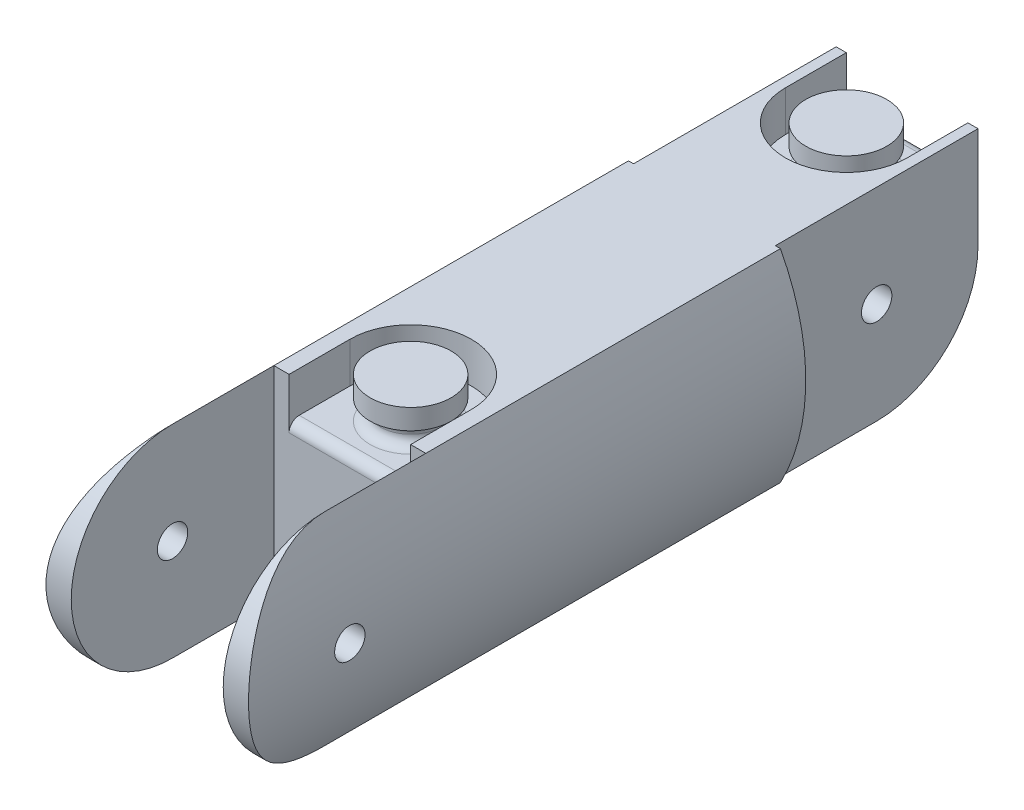
from build123d import *

# Parameters (mm, degrees)
SALIENTE_EXTRUIR2_DEPTH    = 55
CROQUIS4_R                 = 1.5
CORTAR_EXTRUIR1_DEPTH      = 50
SALIENTE_EXTRUIR3_DEPTH    = 20
CROQUIS8_R                 = 1.5
CORTAR_EXTRUIR4_DEPTH      = 14
REDONDEO1_R                = 10
CROQUIS6_W                 = 15
CROQUIS6_H                 = 20
CORTAR_EXTRUIR2_DEPTH      = 20
CORTAR_EXTRUIR3_DEPTH      = 57.789083458
CORTAR_EXTRUIR3_DEPTH_BACK = 57.789083458
CROQUIS7_R                 = 1.5
CUT_EXTRUDE1_DEPTH         = 4
SKETCH2_R                  = 3
BOSS_EXTRUDE1_DEPTH        = 2
SKETCH3_R                  = 4
BOSS_EXTRUDE2_DEPTH        = 2
FILLET1_R                  = 1
FILLET2_R                  = 1
FILLET3_R                  = 1


with BuildPart() as part:
    # Croquis2 → Saliente-Extruir2 (new body)
    with BuildSketch(Plane.XY):
        with BuildLine():
            Line((-7.5, -10), (7.5, -10))
            ThreePointArc((7.5, -10), (10, 0), (7.5, 10))
            Line((7.5, 10), (-7.5, 10))
            ThreePointArc((-7.5, 10), (-10, 0), (-7.5, -10))
        make_face()
    extrude(amount=SALIENTE_EXTRUIR2_DEPTH)

    # Croquis4 → Cortar-Extruir1 (cut)
    with BuildSketch(Plane(origin=(0, 0, 0), x_dir=(-1, 0, 0), z_dir=(0, 0, -1))):
        with Locations((0, -7)):
            Circle(CROQUIS4_R)
    extrude(amount=-CORTAR_EXTRUIR1_DEPTH, mode=Mode.SUBTRACT)

    # Croquis3 → Saliente-Extruir3 (add)
    with BuildSketch(Plane(origin=(0, 0, 0), x_dir=(-1, 0, 0), z_dir=(0, 0, -1))):
        Polygon((7, 10), (7, -10), (3, -10), (3, -3), (-3, -3), (-3, -10), (-7, -10), (-7, 10), align=None)
    extrude(amount=SALIENTE_EXTRUIR3_DEPTH)

    # Croquis8 → Cortar-Extruir4 (cut)
    with BuildSketch(Plane.ZY.offset(7)):
        with Locations((-10, 0)):
            Circle(CROQUIS8_R)
    extrude(amount=-CORTAR_EXTRUIR4_DEPTH, mode=Mode.SUBTRACT)

    # Redondeo1
    redondeo1_edges = [part.edges().sort_by_distance(p)[0] for p in [
        (5, -10, -20),
    ]]
    fillet(redondeo1_edges, radius=REDONDEO1_R)

    # Croquis6 → Cortar-Extruir2 (cut)
    with BuildSketch(Plane.XY.offset(55)):
        Rectangle(CROQUIS6_W, CROQUIS6_H)
    extrude(amount=-CORTAR_EXTRUIR2_DEPTH, mode=Mode.SUBTRACT)

    # Croquis7 → Cortar-Extruir3 (cut, two sides: drawn at the far end of the back side and taken through both)
    with BuildSketch(Plane(origin=(0, 0, 0), x_dir=(0, 0, -1), z_dir=(1, 0, 0)).offset(-CORTAR_EXTRUIR3_DEPTH_BACK)):
        with Locations((-45, 0)):
            Circle(CROQUIS7_R)
        with BuildLine():
            Line((-45, -10), (-60, -10))
            Line((-60, -10), (-60, 10))
            Line((-60, 10), (-45, 10))
            ThreePointArc((-45, 10), (-55, 0), (-45, -10))
        make_face()
    extrude(amount=CORTAR_EXTRUIR3_DEPTH + CORTAR_EXTRUIR3_DEPTH_BACK, mode=Mode.SUBTRACT)

    # Sketch1 → Cut-Extrude1 (cut)
    with BuildSketch(Plane(origin=(0, 10, 0), x_dir=(1, 0, 0), z_dir=(0, 1, 0))):
        with BuildLine():
            Line((-6, 14), (-6, 20))
            Line((-6, 20), (6, 20))
            Line((6, 20), (6, 14))
            ThreePointArc((6, 14), (0, 8), (-6, 14))
        make_face()
        with BuildLine():
            Line((-6, -29), (-6, -35))
            Line((-6, -35), (6, -35))
            Line((6, -35), (6, -29))
            ThreePointArc((6, -29), (0, -23), (-6, -29))
        make_face()
    extrude(amount=-CUT_EXTRUDE1_DEPTH, mode=Mode.SUBTRACT)

    # Sketch2 → Boss-Extrude1 (add)
    with BuildSketch(Plane(origin=(0, 6, 0), x_dir=(1, 0, 0), z_dir=(0, 1, 0))):
        with Locations(Location((0, -29, 0), (0, 0, 270))):
            Circle(SKETCH2_R)
        with Locations(Location((0, 14, 0), (0, 0, 270))):
            Circle(SKETCH2_R)
    extrude(amount=BOSS_EXTRUDE1_DEPTH)

    # Sketch3 → Boss-Extrude2 (add)
    with BuildSketch(Plane(origin=(0, 8, 0), x_dir=(1, 0, 0), z_dir=(0, 1, 0))):
        with Locations(Location((0, 14, 0), (0, 0, 270))):
            Circle(SKETCH3_R)
        with Locations(Location((0, -29, 0), (0, 0, 270))):
            Circle(SKETCH3_R)
    extrude(amount=BOSS_EXTRUDE2_DEPTH)

    # Fillet1
    fillet1_edges = [part.edges().sort_by_distance(p)[0] for p in [
        (0, 6, 26),
        (0, 8, 26),
        (0, 6, -17),
        (0, 8, -17),
    ]]
    fillet(fillet1_edges, radius=FILLET1_R - 0.0001)  # a hair under: the kernel refuses the full size

    # Fillet2
    fillet2_edges = [part.edges().sort_by_distance(p)[0] for p in [
        (0, 6, -20),
        (0, 6, 35),
    ]]
    fillet(fillet2_edges, radius=FILLET2_R)

    # Fillet3
    fillet3_edges = [part.edges().sort_by_distance(p)[0] for p in [
        (1.5, -7, 0),
        (1.5, -7, 35),
    ]]
    fillet(fillet3_edges, radius=FILLET3_R)


solid = part.part
